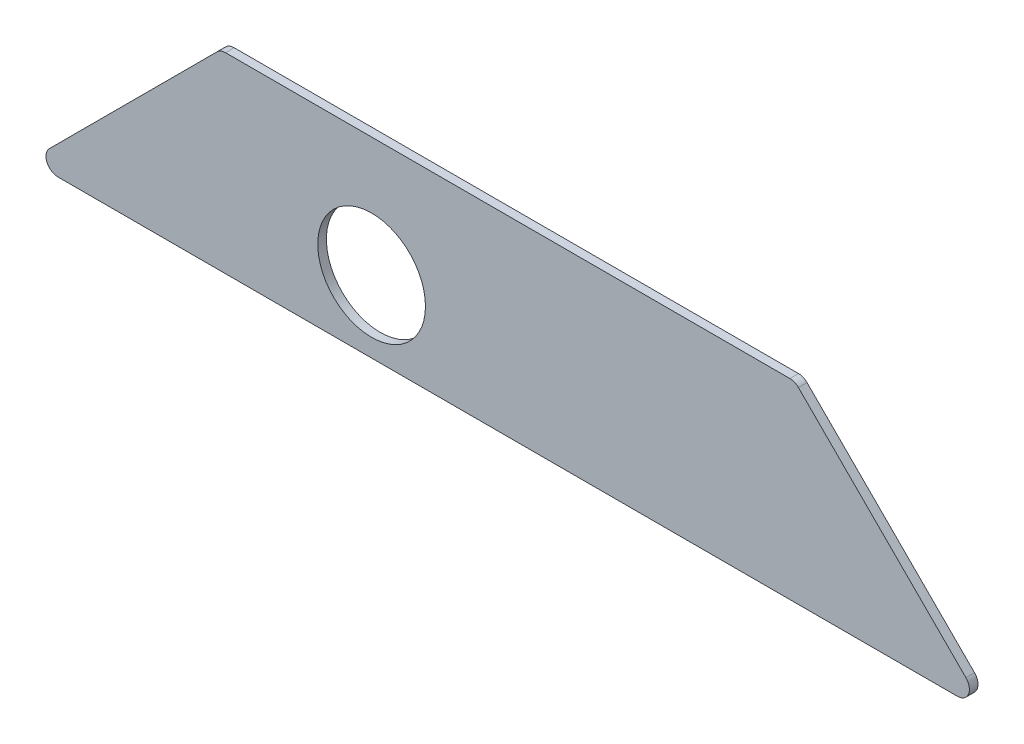
from build123d import *

# Parameters (mm, degrees)
BOSS_EXTRUDE1_DEPTH = 1.143
SKETCH2_R           = 14.2875
CUT_EXTRUDE1_DEPTH  = 131.325197049
FILLET1_R           = 3.175


with BuildPart() as part:
    # Sketch1 → Boss-Extrude1 (new, symmetric)
    with BuildSketch(Plane.XY):
        Polygon((-76.2, 29.162153383), (-127, -21.637846617), (127, -21.637846617), (76.2, 29.162153383), align=None)
    extrude(amount=BOSS_EXTRUDE1_DEPTH, both=True)

    # Sketch2 → Cut-Extrude1 (cut, through all)
    with BuildSketch(Plane.XY.offset(1.143)):
        with Locations((-36.107951031, -2.587846617)):
            Circle(SKETCH2_R)
    extrude(amount=-CUT_EXTRUDE1_DEPTH, mode=Mode.SUBTRACT)

    # Fillet1
    fillet1_edges = [part.edges().sort_by_distance(p)[0] for p in [
        (-127, -21.637846617, 0),
        (-76.2, 29.162153383, 0),
        (127, -21.637846617, 0),
        (76.2, 29.162153383, 0),
    ]]
    fillet(fillet1_edges, radius=FILLET1_R)


solid = part.part
